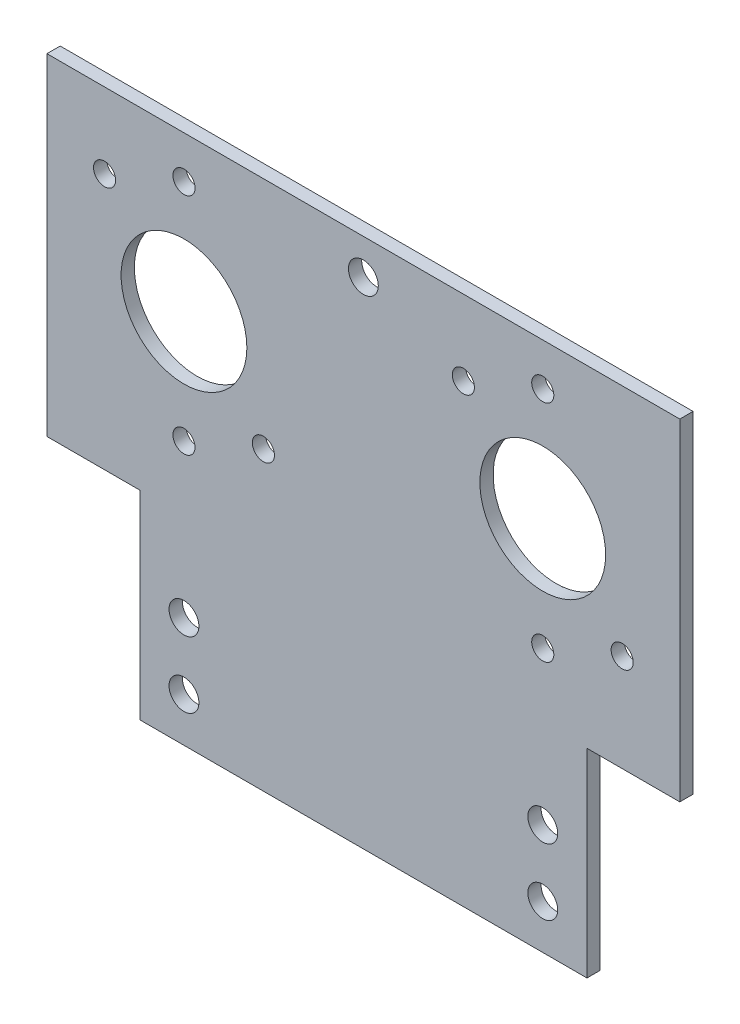
from build123d import *

# Parameters (mm, degrees)
SKETCH1_W           = 143.16
SKETCH1_H           = 120
BOSS_EXTRUDE1_DEPTH = 3
SKETCH2_R           = 14.225
SKETCH2_R_2         = 3.375
CUT_EXTRUDE1_DEPTH  = 187.825548574
SKETCH3_R           = 2.0193
CUT_EXTRUDE2_DEPTH  = 187.825548574
SKETCH6_R           = 2.5
CUT_EXTRUDE3_DEPTH  = 187.825548574
SKETCH7_W           = 21
SKETCH7_H           = 45
CUT_EXTRUDE4_DEPTH  = 187.825548574


with BuildPart() as part:
    # Sketch1 → Boss-Extrude1 (new body)
    with BuildSketch(Plane.XY):
        with Locations((71.58, -60)):
            Rectangle(SKETCH1_W, SKETCH1_H)
    extrude(amount=BOSS_EXTRUDE1_DEPTH)

    # Sketch2 → Cut-Extrude1 (cut, through all)
    with BuildSketch(Plane.XY.offset(3)):
        with Locations((31, -35)):
            Circle(SKETCH2_R)
        with Locations((112.16, -35)):
            Circle(SKETCH2_R)
        with Locations((31, -110)):
            Circle(SKETCH2_R_2)
        with Locations((112.16, -110)):
            Circle(SKETCH2_R_2)
        with Locations((71.58, -8)):
            Circle(SKETCH2_R_2)
        with Locations((31, -95)):
            Circle(SKETCH2_R_2)
        with Locations((112.16, -95)):
            Circle(SKETCH2_R_2)
    extrude(amount=-CUT_EXTRUDE1_DEPTH, mode=Mode.SUBTRACT)

    # Sketch3 → Cut-Extrude2 (cut, through all)
    with BuildSketch(Plane(origin=(0, 0, 0), x_dir=(-1, 0, 0), z_dir=(0, 0, -1))):
        with Locations((-48.960512242, -52.960512242)):
            Circle(SKETCH3_R)
        with Locations((-31, -9.6)):
            Circle(SKETCH3_R)
        with Locations((-13.039487758, -17.039487758)):
            Circle(SKETCH3_R)
        with Locations((-31, -60.4)):
            Circle(SKETCH3_R)
        with Locations((-94.199487758, -17.039487758)):
            Circle(SKETCH3_R)
        with Locations((-112.16, -9.6)):
            Circle(SKETCH3_R)
        with Locations((-112.16, -60.4)):
            Circle(SKETCH3_R)
        with Locations((-130.120512242, -52.960512242)):
            Circle(SKETCH3_R)
    extrude(amount=-CUT_EXTRUDE2_DEPTH, mode=Mode.SUBTRACT)

    # Sketch6 → Cut-Extrude3 (cut, through all)
    with BuildSketch(Plane.XY.offset(3)):
        with Locations((31, -60.4)):
            Circle(SKETCH6_R)
        with Locations((48.960512242, -52.960512242)):
            Circle(SKETCH6_R)
        with Locations((31, -9.6)):
            Circle(SKETCH6_R)
        with Locations((13.039487758, -17.039487758)):
            Circle(SKETCH6_R)
        with Locations((130.120512242, -52.960512242)):
            Circle(SKETCH6_R)
        with Locations((112.16, -60.4)):
            Circle(SKETCH6_R)
        with Locations((94.199487758, -17.039487758)):
            Circle(SKETCH6_R)
        with Locations((112.16, -9.6)):
            Circle(SKETCH6_R)
    extrude(amount=-CUT_EXTRUDE3_DEPTH, mode=Mode.SUBTRACT)

    # Sketch7 → Cut-Extrude4 (cut, through all)
    with BuildSketch(Plane.XY.offset(3)):
        with Locations((132.66, -97.5)):
            Rectangle(SKETCH7_W, SKETCH7_H)
        with Locations((10.5, -97.5)):
            Rectangle(SKETCH7_W, SKETCH7_H)
    extrude(amount=-CUT_EXTRUDE4_DEPTH, mode=Mode.SUBTRACT)


solid = part.part
